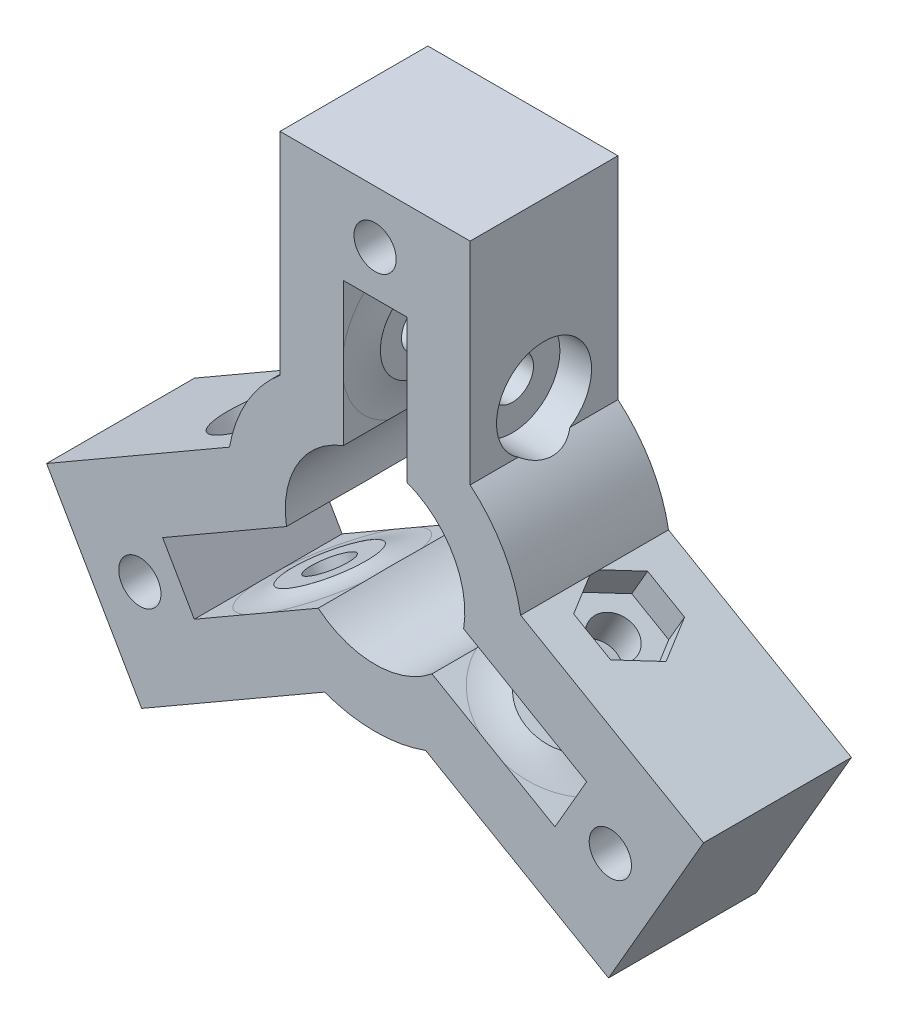
from build123d import *

# Parameters (mm, degrees)
SKETCH_1_R               = 2
EXTRUDE_1_DEPTH          = 14
SKETCH_2_R               = 2
CUT_EXTRUDE_1_DEPTH      = 13
PATTERN_CIRCULAR_1_COUNT = 3
CUT_EXTRUDE_2_DEPTH      = 3
SKETCH_4_R               = 4.5
CUT_EXTRUDE_3_DEPTH      = 3
PATTERN_CIRCULAR_2_COUNT = 3
EXTRUDE_START            = 0.5
SKETCH_5_R               = 4
SKETCH_5_R_2             = 2
EXTRUDE_2_DEPTH          = 0.5
SKETCH_6_R               = 4
SKETCH_6_R_2             = 2
EXTRUDE_3_DEPTH          = 0.5
PATTERN_CIRCULAR_3_COUNT = 3
FILLET_1_R               = 10


with BuildPart() as part:
    # Эскиз1 → Бобышка-Вытянуть1 (new body)
    with BuildSketch(Plane.XY):
        with BuildLine():
            Line((9, 10.723805295), (9, 30.723805295))
            Line((9, 30.723805295), (-9, 30.723805295))
            Line((-9, 30.723805295), (-9, 10.723805295))
            ThreePointArc((-9, 10.723805295), (-12.124355653, 7), (-13.787087811, 2.432325987))
            Line((-13.787087811, 2.432325987), (-31.107595886, -7.567674013))
            Line((-31.107595886, -7.567674013), (-22.107595886, -23.156131281))
            Line((-22.107595886, -23.156131281), (-4.787087811, -13.156131281))
            ThreePointArc((-4.787087811, -13.156131281), (0, -14), (4.787087811, -13.156131281))
            Line((4.787087811, -13.156131281), (22.107595886, -23.156131281))
            Line((22.107595886, -23.156131281), (31.107595886, -7.567674013))
            Line((31.107595886, -7.567674013), (13.787087811, 2.432325987))
            ThreePointArc((13.787087811, 2.432325987), (12.124355653, 7), (9, 10.723805295))
        make_face()
        with Locations((-22.277468867, -12.861902647)):
            Circle(SKETCH_1_R, mode=Mode.SUBTRACT)
        with Locations((22.277468867, -12.861902647)):
            Circle(SKETCH_1_R, mode=Mode.SUBTRACT)
        with BuildLine():
            Line((-5.387488657, -6.574569642), (-17.119546181, -13.348076211))
            Line((-17.119546181, -13.348076211), (-20.119546181, -8.151923789))
            Line((-20.119546181, -8.151923789), (-8.387488657, -1.378417219))
            ThreePointArc((-8.387488657, -1.378417219), (-7.361215932, 4.25), (-3, 7.95298686))
            Line((-3, 7.95298686), (-3, 21.5))
            Line((-3, 21.5), (3, 21.5))
            Line((3, 21.5), (3, 7.95298686))
            ThreePointArc((3, 7.95298686), (6.991065727, 4.834769901), (8.5, 0))
            ThreePointArc((8.5, 0), (8.47182547, -0.691500693), (8.387488657, -1.378417219))
            Line((8.387488657, -1.378417219), (20.032943641, -8.101923789))
            Line((20.032943641, -8.101923789), (17.032943641, -13.298076211))
            Line((17.032943641, -13.298076211), (5.387488657, -6.574569642))
            ThreePointArc((5.387488657, -6.574569642), (0, -8.5), (-5.387488657, -6.574569642))
        make_face(mode=Mode.SUBTRACT)
        with Locations((0, 25.723805295)):
            Circle(SKETCH_1_R, mode=Mode.SUBTRACT)
    extrude(amount=EXTRUDE_1_DEPTH)

    # Эскиз2 → Вырез-Вытянуть1 (cut, symmetric)
    with BuildSketch(Plane(origin=(-1.5, 2.598076211, 0), x_dir=(-0.8660254037844412, -0.49999999999999584, 0), z_dir=(0.49999999999999584, -0.8660254037844412, 0))):
        with Locations((14.5, -7)):
            Circle(SKETCH_2_R)
    cut_extrude_1 = extrude(amount=CUT_EXTRUDE_1_DEPTH, both=True, mode=Mode.SUBTRACT)

    # Круговой массив1: Вырез-Вытянуть1 ×3 about axis
    pattern_circular_1_axis = Axis((0, 0, 14), (0, 0, 1))
    for i in range(1, PATTERN_CIRCULAR_1_COUNT):
        add(cut_extrude_1.rotate(pattern_circular_1_axis, i * 360 / PATTERN_CIRCULAR_1_COUNT), mode=Mode.SUBTRACT)

    # Эскиз3 → Вырез-Вытянуть2 (cut)
    with BuildSketch(Plane.ZY.offset(9)):
        Polygon((10.5, 16.520725942), (7, 18.541451884), (3.5, 16.520725942), (3.5, 12.479274058), (7, 10.458548116), (10.5, 12.479274058), align=None)
    cut_extrude_2 = extrude(amount=-CUT_EXTRUDE_2_DEPTH, mode=Mode.SUBTRACT)

    # Эскиз4 → Вырез-Вытянуть3 (cut, symmetric)
    with BuildSketch(Plane(origin=(9, 0, 0), x_dir=(0, 0, -1), z_dir=(1, 0, 0))):
        with Locations(Location((-7, 14.5, 0), (0, 0, 237.050931562))):
            Circle(SKETCH_4_R)
    cut_extrude_3 = extrude(amount=CUT_EXTRUDE_3_DEPTH, both=True, mode=Mode.SUBTRACT)

    # Круговой массив2: Вырез-Вытянуть2, Вырез-Вытянуть3 ×3 about axis
    pattern_circular_2_axis = Axis((0, 0, 0), (0, 0, 1))
    add([cut_extrude_2.rotate(pattern_circular_2_axis, i * 360 / PATTERN_CIRCULAR_2_COUNT) for i in range(1, PATTERN_CIRCULAR_2_COUNT)], mode=Mode.SUBTRACT)
    add([cut_extrude_3.rotate(pattern_circular_2_axis, i * 360 / PATTERN_CIRCULAR_2_COUNT) for i in range(1, PATTERN_CIRCULAR_2_COUNT)], mode=Mode.SUBTRACT)

    # Эскиз5 → Бобышка-Вытянуть2 (add)
    with BuildSketch(Plane(origin=(-1.5, -2.598076211, 0), x_dir=(0.8660254037844345, -0.5000000000000073, 0), z_dir=(0.5000000000000073, 0.8660254037844345, 0)).offset(EXTRUDE_START)):
        with Locations((14.5, -7)):
            Circle(SKETCH_5_R)
        with Locations((14.5, -7)):
            Circle(SKETCH_5_R_2, mode=Mode.SUBTRACT)
    extrude_2 = extrude(amount=-EXTRUDE_2_DEPTH)

    # Эскиз6 → Бобышка-Вытянуть3 (add)
    with BuildSketch(Plane(origin=(1.5, 2.598076211, 0), x_dir=(-0.8660254037844345, 0.5000000000000074, 0), z_dir=(-0.5000000000000073, -0.8660254037844344, 0))):
        with Locations(Location((-14.5, -7, 0), (0, 0, 180))):
            Circle(SKETCH_6_R)
        with Locations(Location((-14.5, -7, 0), (0, 0, 180))):
            Circle(SKETCH_6_R_2, mode=Mode.SUBTRACT)
    extrude_3 = extrude(amount=EXTRUDE_3_DEPTH)

    # Круговой массив3: Бобышка-Вытянуть2, Бобышка-Вытянуть3 ×3 about axis
    pattern_circular_3_axis = Axis((0, 0, 0), (0, 0, 1))
    add([extrude_2.rotate(pattern_circular_3_axis, i * 360 / PATTERN_CIRCULAR_3_COUNT) for i in range(1, PATTERN_CIRCULAR_3_COUNT)])
    add([extrude_3.rotate(pattern_circular_3_axis, i * 360 / PATTERN_CIRCULAR_3_COUNT) for i in range(1, PATTERN_CIRCULAR_3_COUNT)])

    # Скругление1
    # the kernel refuses this fillet: 10 mm, written as the material it adds along each edge
    with BuildSketch(Plane(origin=(11.057368355, -9.848076211, 7), x_dir=(0.8660254037844346, -0.5000000000000071, 0), z_dir=(0, 0, 1))) as fillet_1_piece_1_section:
        with BuildLine():
            CenterArc((7.122498999, 10), FILLET_1_R, 251.805127661, 18.194872339)
            Line((4, 0.5), (4, 0))
            Line((4, 0), (7.122498999, 0))
        make_face()
    fillet_1_piece_1 = revolve(axis=Axis((11.057368355, -9.848076211, 7), (0.5000000000000073, 0.8660254037844345, 0)), mode=Mode.PRIVATE)
    fillet_1_piece_1 = split(fillet_1_piece_1, bisect_by=Plane(origin=(11.057368355, -9.848076211, 0), z_dir=(0, 0, 1)), keep=Keep.TOP, mode=Mode.PRIVATE)
    fillet_1_piece_1 = split(fillet_1_piece_1, bisect_by=Plane(origin=(11.057368355, -9.848076211, 14), z_dir=(0, 0, -1)), keep=Keep.TOP, mode=Mode.PRIVATE)
    fillet_1_piece_1 = fillet_1_piece_1 - Plane(origin=(0, 0, 7), x_dir=(0.633822194938532, -0.7734787813529868, 0), z_dir=(0, 0, -1)) * Cylinder(8.5, 29, mode=Mode.PRIVATE)
    add(fillet_1_piece_1)
    with BuildSketch(Plane(origin=(14.057368355, -4.651923789, 7), x_dir=(0.8660254037844346, -0.500000000000007, 0), z_dir=(0, 0, -1))) as fillet_1_piece_2_section:
        with BuildLine():
            CenterArc((7.122498999, 10), FILLET_1_R, 251.805127661, 18.194872339)
            Line((4, 0.5), (4, 0))
            Line((4, 0), (7.122498999, 0))
        make_face()
    fillet_1_piece_2 = revolve(axis=Axis((14.057368355, -4.651923789, 7), (-0.5000000000000074, -0.8660254037844345, 0)), mode=Mode.PRIVATE)
    fillet_1_piece_2 = split(fillet_1_piece_2, bisect_by=Plane(origin=(14.057368355, -4.651923789, 0), z_dir=(0, 0, 1)), keep=Keep.TOP, mode=Mode.PRIVATE)
    fillet_1_piece_2 = split(fillet_1_piece_2, bisect_by=Plane(origin=(14.057368355, -4.651923789, 14), z_dir=(0, 0, -1)), keep=Keep.TOP, mode=Mode.PRIVATE)
    fillet_1_piece_2 = fillet_1_piece_2 - Plane(origin=(0, 0, 7), x_dir=(0.35294117647058904, 0.9356455129756978, 0), z_dir=(0, 0, -1)) * Cylinder(8.5, 29, mode=Mode.PRIVATE)
    add(fillet_1_piece_2)
    with BuildSketch(Plane(origin=(3, 14.5, 7), x_dir=(0, 1, 0), z_dir=(0, 0, 1))) as fillet_1_piece_3_section:
        with BuildLine():
            CenterArc((7.122498999, 10), FILLET_1_R, 251.805127661, 18.194872339)
            Line((4, 0.5), (4, 0))
            Line((4, 0), (7.122498999, 0))
        make_face()
    fillet_1_piece_3 = revolve(axis=Axis((3, 14.5, 7), (-1, 0, 0)), mode=Mode.PRIVATE)
    fillet_1_piece_3 = split(fillet_1_piece_3, bisect_by=Plane(origin=(3, 14.5, 0), z_dir=(0, 0, 1)), keep=Keep.TOP, mode=Mode.PRIVATE)
    fillet_1_piece_3 = split(fillet_1_piece_3, bisect_by=Plane(origin=(3, 14.5, 14), z_dir=(0, 0, -1)), keep=Keep.TOP, mode=Mode.PRIVATE)
    fillet_1_piece_3 = fillet_1_piece_3 - Plane(origin=(0, 0, 7), x_dir=(0.35294117647058904, 0.9356455129756978, 0), z_dir=(0, 0, -1)) * Cylinder(8.5, 29, mode=Mode.PRIVATE)
    add(fillet_1_piece_3)
    with BuildSketch(Plane(origin=(-14.057368355, -4.651923789, 7), x_dir=(-0.8660254037844433, -0.49999999999999206, 0), z_dir=(0, 0, 1))) as fillet_1_piece_4_section:
        with BuildLine():
            CenterArc((7.122498999, 10), FILLET_1_R, 251.805127661, 18.194872339)
            Line((4, 0.5), (4, 0))
            Line((4, 0), (7.122498999, 0))
        make_face()
    fillet_1_piece_4 = revolve(axis=Axis((-14.057368355, -4.651923789, 7), (0.49999999999999223, -0.8660254037844431, 0)), mode=Mode.PRIVATE)
    fillet_1_piece_4 = split(fillet_1_piece_4, bisect_by=Plane(origin=(-14.057368355, -4.651923789, 0), z_dir=(0, 0, 1)), keep=Keep.TOP, mode=Mode.PRIVATE)
    fillet_1_piece_4 = split(fillet_1_piece_4, bisect_by=Plane(origin=(-14.057368355, -4.651923789, 14), z_dir=(0, 0, -1)), keep=Keep.TOP, mode=Mode.PRIVATE)
    fillet_1_piece_4 = fillet_1_piece_4 - Plane(origin=(0, 0, 7), x_dir=(-0.9867633714091716, -0.16216673162275091, 0), z_dir=(0, 0, -1)) * Cylinder(8.5, 29, mode=Mode.PRIVATE)
    add(fillet_1_piece_4)
    with BuildSketch(Plane(origin=(-3, 14.5, 7), x_dir=(0, 1, 0), z_dir=(0, 0, -1))) as fillet_1_piece_5_section:
        with BuildLine():
            CenterArc((7.122498999, 10), FILLET_1_R, 251.805127661, 18.194872339)
            Line((4, 0.5), (4, 0))
            Line((4, 0), (7.122498999, 0))
        make_face()
    fillet_1_piece_5 = revolve(axis=Axis((-3, 14.5, 7), (1, 0, 0)), mode=Mode.PRIVATE)
    fillet_1_piece_5 = split(fillet_1_piece_5, bisect_by=Plane(origin=(-3, 14.5, 0), z_dir=(0, 0, 1)), keep=Keep.TOP, mode=Mode.PRIVATE)
    fillet_1_piece_5 = split(fillet_1_piece_5, bisect_by=Plane(origin=(-3, 14.5, 14), z_dir=(0, 0, -1)), keep=Keep.TOP, mode=Mode.PRIVATE)
    fillet_1_piece_5 = fillet_1_piece_5 - Plane(origin=(0, 0, 7), x_dir=(-0.9867633714091716, -0.16216673162275091, 0), z_dir=(0, 0, -1)) * Cylinder(8.5, 29, mode=Mode.PRIVATE)
    add(fillet_1_piece_5)
    with BuildSketch(Plane(origin=(-11.057368355, -9.848076211, 7), x_dir=(-0.8660254037844431, -0.49999999999999223, 0), z_dir=(0, 0, -1))) as fillet_1_piece_6_section:
        with BuildLine():
            CenterArc((7.122498999, 10), FILLET_1_R, 251.805127661, 18.194872339)
            Line((4, 0.5), (4, 0))
            Line((4, 0), (7.122498999, 0))
        make_face()
    fillet_1_piece_6 = revolve(axis=Axis((-11.057368355, -9.848076211, 7), (-0.4999999999999923, 0.8660254037844431, 0)), mode=Mode.PRIVATE)
    fillet_1_piece_6 = split(fillet_1_piece_6, bisect_by=Plane(origin=(-11.057368355, -9.848076211, 0), z_dir=(0, 0, 1)), keep=Keep.TOP, mode=Mode.PRIVATE)
    fillet_1_piece_6 = split(fillet_1_piece_6, bisect_by=Plane(origin=(-11.057368355, -9.848076211, 14), z_dir=(0, 0, -1)), keep=Keep.TOP, mode=Mode.PRIVATE)
    fillet_1_piece_6 = fillet_1_piece_6 - Plane(origin=(0, 0, 7), x_dir=(0.633822194938532, -0.7734787813529868, 0), z_dir=(0, 0, -1)) * Cylinder(8.5, 29, mode=Mode.PRIVATE)
    add(fillet_1_piece_6)


solid = part.part
